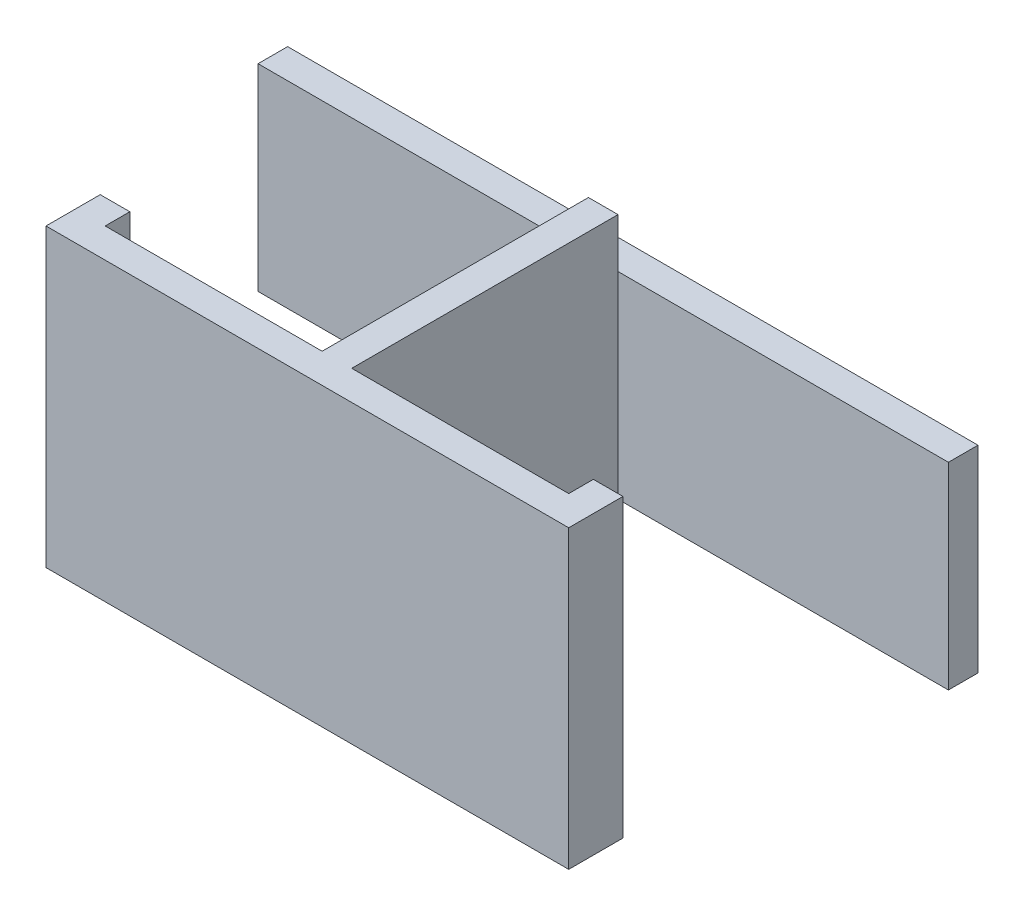
from build123d import *

# Parameters (mm, degrees)
SKETCH1_W           = 88.9
SKETCH1_H           = 25.4
BOSS_EXTRUDE1_DEPTH = 3.81
SKETCH2_W           = 3.81
SKETCH2_H           = 38.1
BOSS_EXTRUDE2_DEPTH = 38.1
SKETCH3_W           = 3.81
SKETCH3_H           = 38.1
BOSS_EXTRUDE3_DEPTH = 31.75
SKETCH4_W           = 3.81
SKETCH4_H           = 38.1
BOSS_EXTRUDE4_DEPTH = 3.175


with BuildPart() as part:
    # Sketch1 → Boss-Extrude1 (new body)
    with BuildSketch(Plane.XY):
        with Locations((-44.45, 12.7)):
            Rectangle(SKETCH1_W, SKETCH1_H)
    extrude(amount=BOSS_EXTRUDE1_DEPTH)

    # Sketch2 → Boss-Extrude2 (add)
    with BuildSketch(Plane.XY.offset(3.81)):
        with Locations((-44.45, 12.7)):
            Rectangle(SKETCH2_W, SKETCH2_H)
    extrude(amount=BOSS_EXTRUDE2_DEPTH)

    # Sketch3 → Boss-Extrude3 (add)
    with BuildSketch(Plane(origin=(-42.545, 0, 0), x_dir=(0, 0, -1), z_dir=(1, 0, 0))):
        with Locations((-40.005, 12.7)):
            Rectangle(SKETCH3_W, SKETCH3_H)
    boss_extrude3 = extrude(amount=BOSS_EXTRUDE3_DEPTH)

    # Sketch4 → Boss-Extrude4 (add)
    with BuildSketch(Plane(origin=(0, 0, 38.1), x_dir=(-1, 0, 0), z_dir=(0, 0, -1))):
        with Locations((12.7, 12.7)):
            Rectangle(SKETCH4_W, SKETCH4_H)
    boss_extrude4 = extrude(amount=BOSS_EXTRUDE4_DEPTH)

    # Mirror2: Boss-Extrude3, Boss-Extrude4 across plane
    add(boss_extrude3.mirror(Plane.ZY.offset(44.45)))
    add(boss_extrude4.mirror(Plane.ZY.offset(44.45)))


solid = part.part
